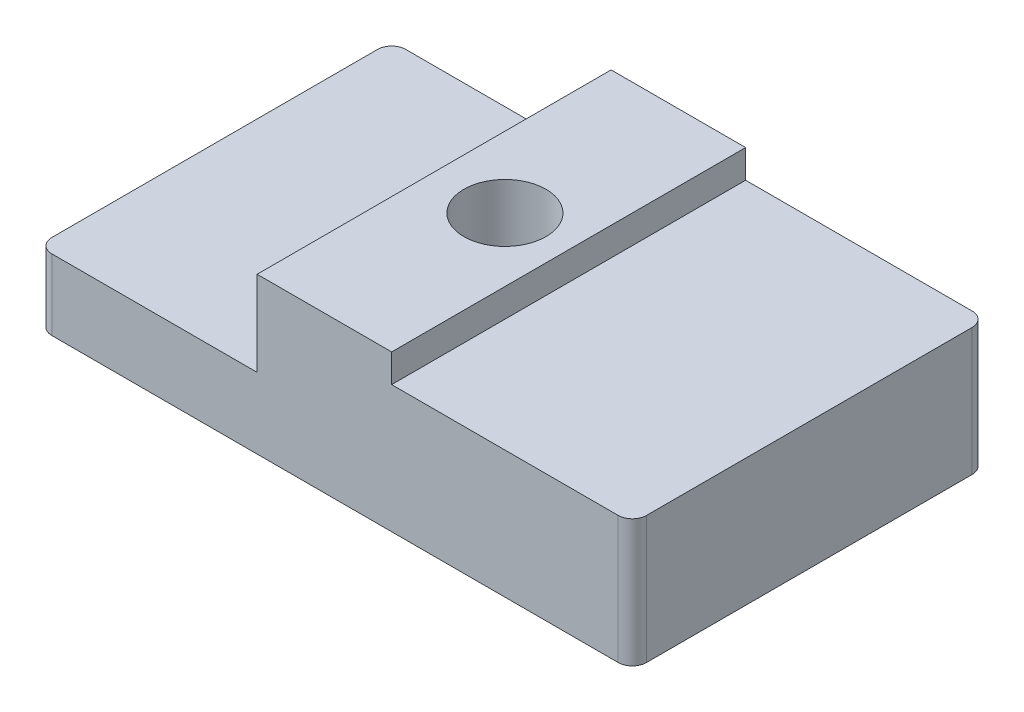
from build123d import *

# Parameters (mm, degrees)
SKETCH1_W            = 45
SKETCH1_H            = 25
BOSS_EXTRUDE1_DEPTH  = 5
SKETCH5_W            = 26.5
SKETCH5_H            = 25
BOSS_EXTRUDE3_DEPTH  = 4
SKETCH11_W           = 9.5
SKETCH11_H           = 25
BOSS_EXTRUDE5_DEPTH  = 2
SKETCH12_W           = 3
SKETCH12_H           = 25
CUT_EXTRUDE2_DEPTH   = 52.826634079
M5_CLEARANCE_HOLE1_D = 5.8
FILLET1_R            = 1


with BuildPart() as part:
    # Sketch1 → Boss-Extrude1 (new body)
    with BuildSketch(Plane(origin=(0, 0, 0), x_dir=(1, 0, 0), z_dir=(0, 1, 0))):
        with Locations((22.5, 12.5)):
            Rectangle(SKETCH1_W, SKETCH1_H)
    extrude(amount=BOSS_EXTRUDE1_DEPTH)

    # Sketch5 → Boss-Extrude3 (add)
    with BuildSketch(Plane(origin=(0, 5, 0), x_dir=(1, 0, 0), z_dir=(0, 1, 0))):
        with Locations((31.75, 12.5)):
            Rectangle(SKETCH5_W, SKETCH5_H)
    extrude(amount=BOSS_EXTRUDE3_DEPTH)

    # Sketch11 → Boss-Extrude5 (add)
    with BuildSketch(Plane(origin=(0, 9, 0), x_dir=(1, 0, 0), z_dir=(0, 1, 0))):
        with Locations((23.25, 12.5)):
            Rectangle(SKETCH11_W, SKETCH11_H)
    extrude(amount=BOSS_EXTRUDE5_DEPTH)

    # Sketch12 → Cut-Extrude2 (cut, through all)
    with BuildSketch(Plane(origin=(0, 5, 0), x_dir=(1, 0, 0), z_dir=(0, 1, 0))):
        with Locations((1.5, 12.5)):
            Rectangle(SKETCH12_W, SKETCH12_H)
    extrude(amount=-CUT_EXTRUDE2_DEPTH, mode=Mode.SUBTRACT)

    # M5 Clearance Hole1 (through all)
    with Locations(Plane(origin=(0, 0, 0), x_dir=(-1, 0, 0), z_dir=(0, -1, 0))):
        with Locations((-23.5, 12.5)):
            Hole(M5_CLEARANCE_HOLE1_D / 2)

    # Fillet1
    fillet1_edges = [part.edges().sort_by_distance(p)[0] for p in [
        (45, 4.5, -25),
        (45, 4.5, 0),
        (3, 2.5, -25),
        (3, 2.5, 0),
    ]]
    fillet(fillet1_edges, radius=FILLET1_R)


solid = part.part
